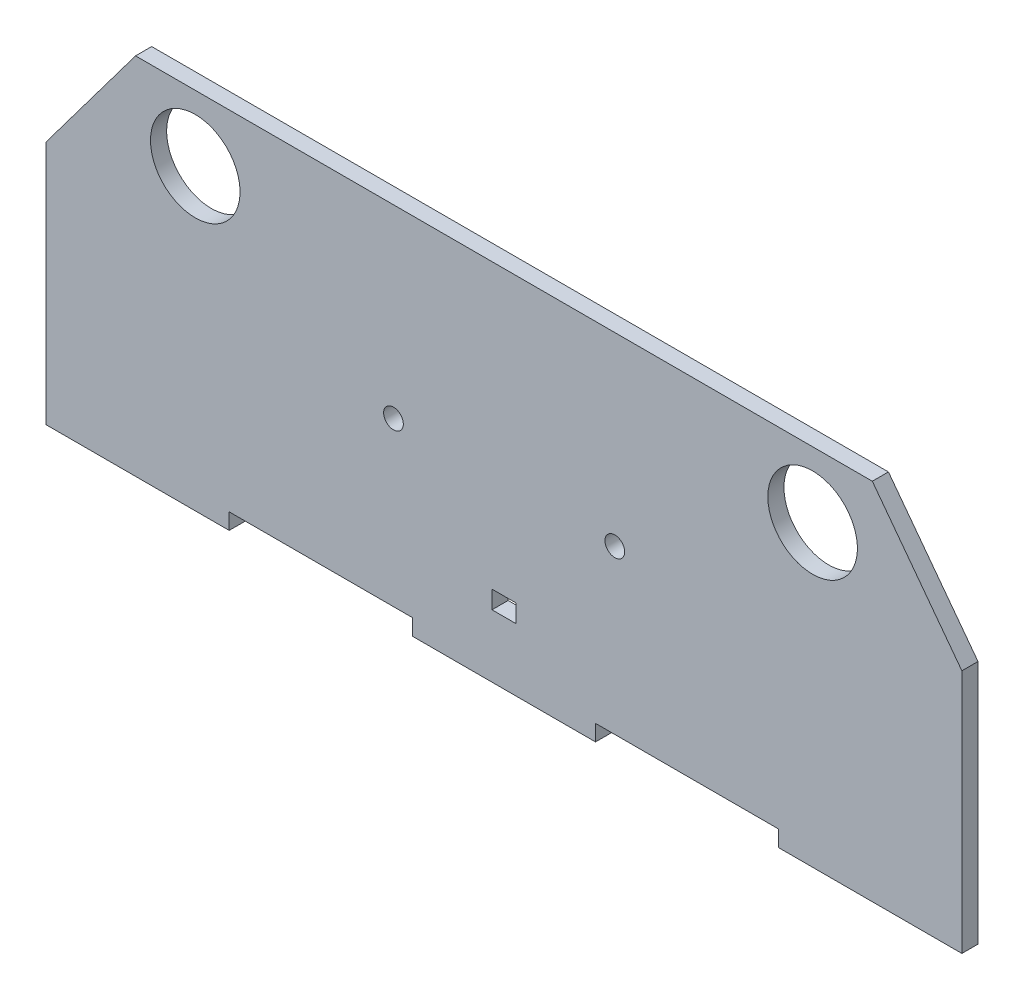
from build123d import *

# Parameters (mm, degrees)
SKETCH1_R           = 1.65
SKETCH1_R_2         = 7.5
SKETCH1_W           = 4
SKETCH1_H           = 3
BOSS_EXTRUDE3_DEPTH = 2.7


with BuildPart() as part:
    # Sketch1 → Boss-Extrude3 (new body)
    with BuildSketch(Plane.XY):
        Polygon((-61.7, 33), (61.7, 33), (76.7, 13), (76.7, -23), (76.7, -25.3), (76.7, -28), (46.02, -28), (46.02, -25.3), (15.34, -25.3), (15.34, -28), (-15.34, -28), (-15.34, -25.3), (-46.02, -25.3), (-46.02, -28), (-76.7, -28), (-76.7, -25.3), (-76.7, -23), (-76.7, 13), align=None)
        with Locations((-18.5, 2)):
            Circle(SKETCH1_R, mode=Mode.SUBTRACT)
        with Locations((18.567940233, 2)):
            Circle(SKETCH1_R, mode=Mode.SUBTRACT)
        with Locations((-51.7, 22)):
            Circle(SKETCH1_R_2, mode=Mode.SUBTRACT)
        with Locations((51.7, 22)):
            Circle(SKETCH1_R_2, mode=Mode.SUBTRACT)
        with Locations((0, -16)):
            Rectangle(SKETCH1_W, SKETCH1_H, mode=Mode.SUBTRACT)
    extrude(amount=BOSS_EXTRUDE3_DEPTH)


solid = part.part
